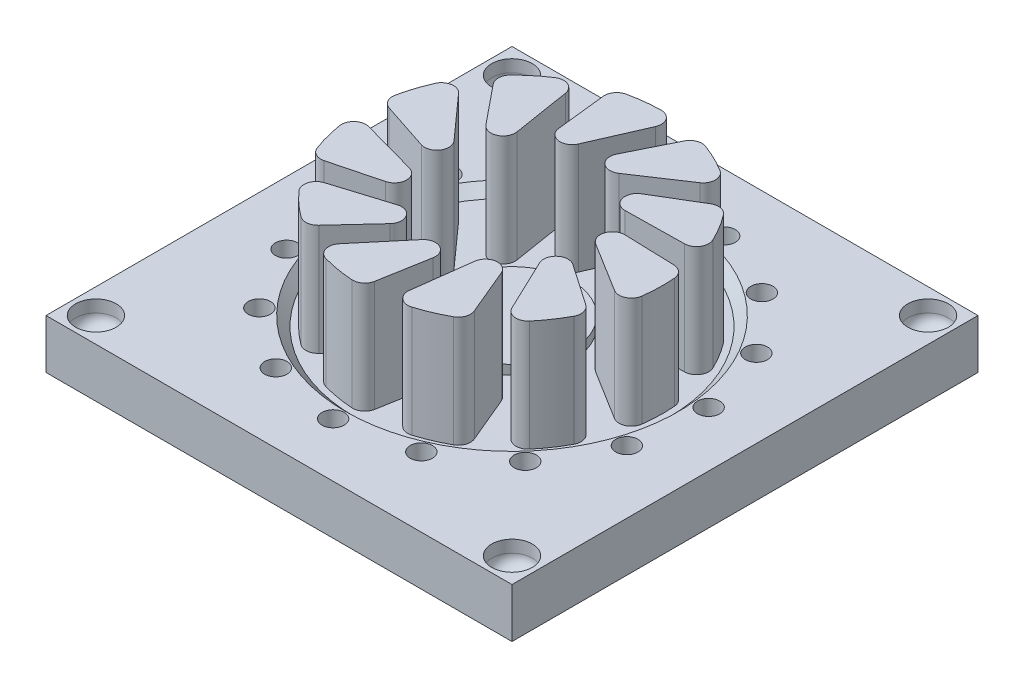
from build123d import *

# Parameters (mm, degrees)
SKETCH1_W               = 42
SKETCH1_H               = 42
BOSS_EXTRUDE1_DEPTH     = 6.5
SKETCH2_R               = 14
SKETCH2_R_2             = 5.9
BOSS_EXTRUDE2_DEPTH     = 9.15
CAVITY1_START           = 5.65
CAVITY1_OUTLINE_R       = 5.4
CAVITY1_DEPTH           = 10
SKETCH5_W               = 42
SKETCH5_H               = 42
CUT_EXTRUDE1_DEPTH      = 8.55
SKETCH6_R               = 1.83
CUT_EXTRUDE2_DEPTH      = 2.1
FILLET1_R               = 1
CUT_EXTRUDE5_DEPTH      = 33.66435366
CUT_EXTRUDE5_DEPTH_BACK = 33.66435366
SKETCH8_R               = 1
CUT_EXTRUDE6_START      = -10
CUT_EXTRUDE6_DEPTH      = 10


with BuildPart() as part:
    # Sketch1 → Boss-Extrude1 (new, symmetric)
    with BuildSketch(Plane(origin=(0, 0, 0), x_dir=(1, 0, 0), z_dir=(0, 1, 0))):
        Rectangle(SKETCH1_W, SKETCH1_H)
    extrude(amount=BOSS_EXTRUDE1_DEPTH, both=True)

    # Sketch2 → Boss-Extrude2 (add)
    with BuildSketch(Plane(origin=(0, 6.5, 0), x_dir=(1, 0, 0), z_dir=(0, 1, 0))):
        with Locations(Location((0, 0, 0), (0, 0, 270))):
            Circle(SKETCH2_R)
        with Locations(Location((0, 0, 0), (0, 0, 270))):
            Circle(SKETCH2_R_2, mode=Mode.SUBTRACT)
    extrude(amount=BOSS_EXTRUDE2_DEPTH)

    # Cavity1: read off the stored shape, not the designer's step
    # Cavity1 outline → Cavity1 (cut)
    with BuildSketch(Plane(origin=(0, 0, 0), x_dir=(1, 0, 0), z_dir=(0, 1, 0)).offset(CAVITY1_START)):
        with BuildLine():
            Line((-4.533292403, -11.068981767), (-1.149066665, -7.035818585))
            ThreePointArc((-1.149066665, -7.035818585), (0.633927393, -6.640538319), (1.47721163, -8.260472267))
            Line((1.47721163, -8.260472267), (0.68813613, -12.7355418))
            ThreePointArc((0.68813613, -12.7355418), (0.138338934, -13.654010782), (-0.883764559, -13.972077877))
            ThreePointArc((-0.883764559, -13.972077877), (1.633368507, -13.904391656), (4.097662599, -13.3869026))
            ThreePointArc((4.097662599, -13.3869026), (2.691904846, -13.099521272), (2.170695102, -11.762702927))
            Line((2.170695102, -11.762702927), (2.83719432, -6.540139582))
            ThreePointArc((2.83719432, -6.540139582), (4.123439724, -5.243649297), (5.708657981, -6.150510574))
            Line((5.708657981, -6.150510574), (7.46425068, -10.341785051))
            ThreePointArc((7.46425068, -10.341785051), (7.498293668, -11.411693133), (6.810405547, -12.231859069))
            ThreePointArc((6.810405547, -12.231859069), (8.891358698, -10.814052918), (10.684679103, -9.046415448))
            ThreePointArc((10.684679103, -9.046415448), (9.346710352, -9.564664912), (8.185502249, -8.721849019))
            Line((8.185502249, -8.721849019), (5.922666155, -3.968012472))
            ThreePointArc((5.922666155, -3.968012472), (6.303789078, -2.181938673), (8.127645759, -2.087805232))
            Line((8.127645759, -2.087805232), (11.870518379, -4.664584621))
            ThreePointArc((11.870518379, -4.664584621), (12.477593142, -5.546243546), (12.342320013, -6.608111432))
            ThreePointArc((12.342320013, -6.608111432), (13.326405326, -4.290328786), (13.879385486, -1.833755311))
            ThreePointArc((13.879385486, -1.833755311), (13.03400136, -2.993095023), (11.601470268, -2.911869673))
            Line((11.601470268, -2.911869673), (7.127733334, -0.136069439))
            ThreePointArc((7.127733334, -0.136069439), (6.48272994, 1.572522062), (7.966163435, 2.63776352))
            Line((7.966163435, 2.63776352), (12.507980365, 2.493588468))
            ThreePointArc((12.507980365, 2.493588468), (13.495344957, 2.08009918), (13.955635081, 1.113664893))
            ThreePointArc((13.955635081, 1.113664893), (13.530412422, 3.59554442), (12.667485044, 5.961109181))
            ThreePointArc((12.667485044, 5.961109181), (12.583089031, 4.528761388), (11.334053449, 3.82260772))
            Line((11.334053449, 3.82260772), (6.069795541, 3.73907468))
            ThreePointArc((6.069795541, 3.73907468), (4.603449851, 4.827718154), (5.275480507, 6.525860991))
            Line((5.275480507, 6.525860991), (9.174246963, 8.860064838))
            ThreePointArc((9.174246963, 8.860064838), (10.228420101, 9.046025113), (11.138134616, 8.481860484))
            ThreePointArc((11.138134616, 8.481860484), (9.438609176, 10.339857679), (7.433747604, 11.863363627))
            ThreePointArc((7.433747604, 11.863363627), (8.137134842, 10.612768057), (7.468154743, 9.343434171))
            Line((7.468154743, 9.343434171), (3.084740551, 6.427089007))
            ThreePointArc((3.084740551, 6.427089007), (1.262606961, 6.550147844), (0.909869793, 8.342043708))
            Line((0.909869793, 8.342043708), (2.927754972, 12.413533223))
            ThreePointArc((2.927754972, 12.413533223), (3.714044133, 13.139901989), (4.78435511, 13.157125301))
            ThreePointArc((4.78435511, 13.157125301), (2.350114207, 13.801339182), (-0.160152175, 13.999083944))
            ThreePointArc((-0.160152175, 13.999083944), (1.107697836, 13.327295854), (1.231169673, 11.89778629))
            Line((1.231169673, 11.89778629), (-0.879697769, 7.074547986))
            ThreePointArc((-0.879697769, 7.074547986), (-2.479104719, 6.192951873), (-3.744618151, 7.509686489))
            Line((-3.744618151, 7.509686489), (-4.248278536, 12.02579252))
            ThreePointArc((-4.248278536, 12.02579252), (-3.979514604, 13.061952825), (-3.08842334, 13.655095799))
            ThreePointArc((-3.08842334, 13.655095799), (-5.484525418, 12.88099301), (-7.70320477, 11.690194022))
            ThreePointArc((-7.70320477, 11.690194022), (-6.273425408, 11.810501383), (-5.396703069, 10.674675328))
            Line((-5.396703069, 10.674675328), (-4.564838262, 5.475887966))
            ThreePointArc((-4.564838262, 5.475887966), (-5.433718166, 3.869537441), (-7.210216291, 4.293056871))
            Line((-7.210216291, 4.293056871), (-10.075513626, 7.819947663))
            ThreePointArc((-10.075513626, 7.819947663), (-10.409605573, 8.836925932), (-9.980649201, 9.817669863))
            ThreePointArc((-9.980649201, 9.817669863), (-11.577866975, 7.871022571), (-12.800544279, 5.669750096))
            ThreePointArc((-12.800544279, 5.669750096), (-11.66278041, 6.543956173), (-10.311160718, 6.062430373))
            Line((-10.311160718, 6.062430373), (-6.800674861, 2.138672207))
            ThreePointArc((-6.800674861, 2.138672207), (-6.663164489, 0.317572211), (-8.386621704, -0.28658797))
            Line((-8.386621704, -0.28658797), (-12.703844329, 1.131324675))
            ThreePointArc((-12.703844329, 1.131324675), (-13.534720323, 1.806237493), (-13.70408946, 2.863203114))
            ThreePointArc((-13.70408946, 2.863203114), (-13.995317572, 0.362058079), (-13.833801424, -2.150799424))
            ThreePointArc((-13.833801424, -2.150799424), (-13.349285037, -0.800248885), (-11.951897694, -0.474593391))
            Line((-11.951897694, -0.474593391), (-6.877345242, -1.877556866))
            ThreePointArc((-6.877345242, -1.877556866), (-5.777103166, -3.335219951), (-6.900333982, -4.775243156))
            Line((-6.900333982, -4.775243156), (-11.29879422, -5.916485904))
            ThreePointArc((-11.29879422, -5.916485904), (-12.362657002, -5.797918587), (-13.076578144, -5.000310394))
            ThreePointArc((-13.076578144, -5.000310394), (-11.969353727, -7.261857295), (-10.474924362, -9.288485324))
            ThreePointArc((-10.474924362, -9.288485324), (-10.797485986, -7.890380576), (-9.7979916, -6.860937106))
            Line((-9.7979916, -6.860937106), (-4.770507103, -5.2976749))
            ThreePointArc((-4.770507103, -5.2976749), (-3.056852407, -5.929103345), (-3.223238977, -7.74779238))
            Line((-3.223238977, -7.74779238), (-6.306456779, -11.085854011))
            ThreePointArc((-6.306456779, -11.085854011), (-7.265537434, -11.561276482), (-8.297345663, -11.276260681))
            ThreePointArc((-8.297345663, -11.276260681), (-6.143204645, -12.580184287), (-3.790332827, -13.477142763))
            ThreePointArc((-3.790332827, -13.477142763), (-4.817561427, -12.475372185), (-4.533292403, -11.068981767))
        make_face()
        Circle(CAVITY1_OUTLINE_R, mode=Mode.SUBTRACT)
    extrude(amount=CAVITY1_DEPTH, mode=Mode.SUBTRACT)

    # Cavity1 2 outline → Cavity1 2 (revolve, cut)
    with BuildSketch(Plane.XY):
        Polygon((14, 6.5), (14, 5.65), (14.15, 5.65), (15, 6.5), align=None)
    revolve(axis=Axis((0, 0, 0), (0, 1, 0)), mode=Mode.SUBTRACT)

    # Sketch5 → Cut-Extrude1 (cut)
    with BuildSketch(Plane.XZ.offset(6.5)):
        Rectangle(SKETCH5_W, SKETCH5_H)
    extrude(amount=-CUT_EXTRUDE1_DEPTH, mode=Mode.SUBTRACT)

    # Sketch6 → Cut-Extrude2 (cut)
    with BuildSketch(Plane(origin=(0, 6.5, 0), x_dir=(1, 0, 0), z_dir=(0, 1, 0))):
        with Locations(Location((-18.75, -18.75, 0), (0, 0, 270))):
            Circle(SKETCH6_R)
        with Locations(Location((18.75, -18.75, 0), (0, 0, 270))):
            Circle(SKETCH6_R)
        with Locations(Location((18.75, 18.75, 0), (0, 0, 270))):
            Circle(SKETCH6_R)
        with Locations(Location((-18.75, 18.75, 0), (0, 0, 270))):
            Circle(SKETCH6_R)
    extrude(amount=-CUT_EXTRUDE2_DEPTH, mode=Mode.SUBTRACT)

    # Fillet1
    fillet1_edges = [part.edges().sort_by_distance(p)[0] for p in [
        (18.75, 4.4, -20.58),
        (-18.75, 4.4, 16.92),
        (-18.75, 4.4, -20.58),
        (18.75, 4.4, 16.92),
    ]]
    fillet(fillet1_edges, radius=FILLET1_R)

    # Sketch8 → Cut-Extrude5 (cut, two sides: drawn at the far end of the back side and taken through both)
    with BuildSketch(Plane.XZ.offset(-2.05).offset(-CUT_EXTRUDE5_DEPTH_BACK)):
        with Locations(Location((0, 16.125, 0), (0, 0, 270))):
            Circle(SKETCH8_R)
        with Locations(Location((6.55862837, 14.730920504, 0), (0, 0, 270))):
            Circle(SKETCH8_R)
        with Locations(Location((11.983210311, 10.789731028, 0), (0, 0, 270))):
            Circle(SKETCH8_R)
        with Locations(Location((15.335786325, 4.982899034, 0), (0, 0, 270))):
            Circle(SKETCH8_R)
        with Locations(Location((16.036665563, -1.68552147, 0), (0, 0, 270))):
            Circle(SKETCH8_R)
        with Locations(Location((13.964659636, -8.0625, 0), (0, 0, 270))):
            Circle(SKETCH8_R)
        with Locations(Location((9.478037193, -13.045399034, 0), (0, 0, 270))):
            Circle(SKETCH8_R)
        with Locations(Location((3.352576014, -15.772630062, 0), (0, 0, 270))):
            Circle(SKETCH8_R)
        with Locations(Location((-3.352576014, -15.772630062, 0), (0, 0, 270))):
            Circle(SKETCH8_R)
        with Locations(Location((-9.478037193, -13.045399034, 0), (0, 0, 270))):
            Circle(SKETCH8_R)
        with Locations(Location((-13.964659636, -8.0625, 0), (0, 0, 270))):
            Circle(SKETCH8_R)
        with Locations(Location((-16.036665563, -1.68552147, 0), (0, 0, 270))):
            Circle(SKETCH8_R)
        with Locations(Location((-15.335786325, 4.982899034, 0), (0, 0, 270))):
            Circle(SKETCH8_R)
        with Locations(Location((-11.983210311, 10.789731028, 0), (0, 0, 270))):
            Circle(SKETCH8_R)
        with Locations(Location((-6.55862837, 14.730920504, 0), (0, 0, 270))):
            Circle(SKETCH8_R)
    extrude(amount=CUT_EXTRUDE5_DEPTH + CUT_EXTRUDE5_DEPTH_BACK, mode=Mode.SUBTRACT)

    # Sketch9 → Cut-Extrude6 (cut)
    # profile 1 of 11: a face of its own
    with BuildSketch(Plane(origin=(0, 15.65, 0), x_dir=(1, 0, 0), z_dir=(0, 1, 0)).offset(CUT_EXTRUDE6_START)):
        with BuildLine():
            Line((-6.800674861, 2.138672207), (-10.311160718, 6.062430373))
            ThreePointArc((-10.311160718, 6.062430373), (-11.662780409, 6.543956173), (-12.800544279, 5.669750096))
            ThreePointArc((-12.800544279, 5.669750096), (-13.326405326, 4.290328786), (-13.70408946, 2.863203114))
            ThreePointArc((-13.70408946, 2.863203114), (-13.534720323, 1.806237493), (-12.703844329, 1.131324675))
            Line((-12.703844329, 1.131324675), (-8.386621704, -0.28658797))
            ThreePointArc((-8.386621704, -0.28658797), (-6.663164489, 0.317572211), (-6.800674861, 2.138672207))
        make_face()
        with BuildLine():
            Line((-7.09878064, 1.871964607), (-10.609266497, 5.795722772))
            ThreePointArc((-10.609266497, 5.795722772), (-11.600454271, 6.148841693), (-12.434814443, 5.507757237))
            ThreePointArc((-12.434814443, 5.507757237), (-12.945650888, 4.167747964), (-13.312544047, 2.78139731))
            ThreePointArc((-13.312544047, 2.78139731), (-13.188340013, 2.006289188), (-12.579030951, 1.511353122))
            Line((-12.579030951, 1.511353122), (-8.261808325, 0.093440477))
            ThreePointArc((-8.261808325, 0.093440477), (-6.997939701, 0.536491277), (-7.09878064, 1.871964607))
        make_face(mode=Mode.SUBTRACT)
    # profile 2 of 11: a face of its own
    with BuildSketch(Plane(origin=(0, 15.65, 0), x_dir=(1, 0, 0), z_dir=(0, 1, 0)).offset(CUT_EXTRUDE6_START)):
        with BuildLine():
            Line((-6.877345242, -1.877556866), (-11.951897694, -0.474593391))
            ThreePointArc((-11.951897694, -0.474593391), (-13.349285037, -0.800248885), (-13.833801424, -2.150799424))
            ThreePointArc((-13.833801424, -2.150799424), (-13.530412422, -3.595544421), (-13.076578144, -5.000310394))
            ThreePointArc((-13.076578144, -5.000310394), (-12.362657002, -5.797918587), (-11.29879422, -5.916485904))
            Line((-11.29879422, -5.916485904), (-6.900333982, -4.775243156))
            ThreePointArc((-6.900333982, -4.775243156), (-5.777103166, -3.335219951), (-6.877345242, -1.877556866))
        make_face()
        with BuildLine():
            Line((-6.983934768, -2.26309373), (-12.058487219, -0.860130254))
            ThreePointArc((-12.058487219, -0.860130254), (-13.083237937, -1.098944283), (-13.438549955, -2.089348012))
            ThreePointArc((-13.438549955, -2.089348012), (-13.14382921, -3.49281458), (-12.702961626, -4.857444382))
            ThreePointArc((-12.702961626, -4.857444382), (-12.179419455, -5.442357058), (-11.399253414, -5.529306423))
            Line((-11.399253414, -5.529306423), (-7.000793177, -4.388063676))
            ThreePointArc((-7.000793177, -4.388063676), (-6.177090578, -3.332046659), (-6.983934768, -2.26309373))
        make_face(mode=Mode.SUBTRACT)
    # profile 3 of 11: a face of its own
    with BuildSketch(Plane(origin=(0, 15.65, 0), x_dir=(1, 0, 0), z_dir=(0, 1, 0)).offset(CUT_EXTRUDE6_START)):
        with BuildLine():
            Line((-4.770507103, -5.2976749), (-9.7979916, -6.860937106))
            ThreePointArc((-9.7979916, -6.860937106), (-10.797485986, -7.890380577), (-10.474924362, -9.288485324))
            ThreePointArc((-10.474924362, -9.288485324), (-9.438609176, -10.339857679), (-8.297345663, -11.276260681))
            ThreePointArc((-8.297345663, -11.276260681), (-7.265537434, -11.561276482), (-6.306456779, -11.085854011))
            Line((-6.306456779, -11.085854011), (-3.223238977, -7.74779238))
            ThreePointArc((-3.223238977, -7.74779238), (-3.056852407, -5.929103345), (-4.770507103, -5.2976749))
        make_face()
        with BuildLine():
            Line((-4.651738953, -5.679635797), (-9.67922345, -7.242898003))
            ThreePointArc((-9.67922345, -7.242898003), (-10.412186, -7.997823214), (-10.175640808, -9.023100029))
            ThreePointArc((-10.175640808, -9.023100029), (-9.168934628, -10.044433174), (-8.060278644, -10.954081805))
            ThreePointArc((-8.060278644, -10.954081805), (-7.303619276, -11.163093392), (-6.600293462, -10.814450247))
            Line((-6.600293462, -10.814450247), (-3.51707566, -7.476388615))
            ThreePointArc((-3.51707566, -7.476388615), (-3.395058842, -6.142683323), (-4.651738953, -5.679635797))
        make_face(mode=Mode.SUBTRACT)
    # profile 4 of 11: a face of its own
    with BuildSketch(Plane(origin=(0, 15.65, 0), x_dir=(1, 0, 0), z_dir=(0, 1, 0)).offset(CUT_EXTRUDE6_START)):
        with BuildLine():
            Line((-1.149066665, -7.035818585), (-4.533292403, -11.068981767))
            ThreePointArc((-4.533292403, -11.068981767), (-4.817561427, -12.475372186), (-3.790332827, -13.477142763))
            ThreePointArc((-3.790332827, -13.477142763), (-2.350114207, -13.801339182), (-0.883764559, -13.972077877))
            ThreePointArc((-0.883764559, -13.972077877), (0.138338934, -13.654010782), (0.68813613, -12.7355418))
            Line((0.68813613, -12.7355418), (1.47721163, -8.260472267))
            ThreePointArc((1.47721163, -8.260472267), (0.633927393, -6.640538319), (-1.149066665, -7.035818585))
        make_face()
        with BuildLine():
            Line((-0.842648887, -7.292933629), (-4.226874626, -11.326096811))
            ThreePointArc((-4.226874626, -11.326096811), (-4.435338577, -12.357449785), (-3.682037603, -13.092081542))
            ThreePointArc((-3.682037603, -13.092081542), (-2.282968087, -13.407015205), (-0.858514143, -13.572875652))
            ThreePointArc((-0.858514143, -13.572875652), (-0.108971581, -13.339626449), (0.294213029, -12.666082529))
            Line((0.294213029, -12.666082529), (1.083288528, -8.191012995))
            ThreePointArc((1.083288528, -8.191012995), (0.464880088, -7.003061434), (-0.842648887, -7.292933629))
        make_face(mode=Mode.SUBTRACT)
    # profile 5 of 11: a face of its own
    with BuildSketch(Plane(origin=(0, 15.65, 0), x_dir=(1, 0, 0), z_dir=(0, 1, 0)).offset(CUT_EXTRUDE6_START)):
        with BuildLine():
            Line((2.83719432, -6.540139582), (2.170695102, -11.762702927))
            ThreePointArc((2.170695102, -11.762702927), (2.691904846, -13.099521272), (4.097662599, -13.3869026))
            ThreePointArc((4.097662599, -13.3869026), (5.484525418, -12.88099301), (6.810405547, -12.231859069))
            ThreePointArc((6.810405547, -12.231859069), (7.498293668, -11.411693133), (7.46425068, -10.341785051))
            Line((7.46425068, -10.341785051), (5.708657981, -6.150510574))
            ThreePointArc((5.708657981, -6.150510574), (4.123439724, -5.243649297), (2.83719432, -6.540139582))
        make_face()
        with BuildLine():
            Line((3.233976246, -6.590776564), (2.567477027, -11.813339908))
            ThreePointArc((2.567477027, -11.813339908), (2.949697506, -12.793673362), (3.980586525, -13.004419669))
            ThreePointArc((3.980586525, -13.004419669), (5.327824692, -12.512964639), (6.615822532, -11.882377381))
            ThreePointArc((6.615822532, -11.882377381), (7.12027382, -11.280922362), (7.095308962, -10.496323102))
            Line((7.095308962, -10.496323102), (5.339716263, -6.305048624))
            ThreePointArc((5.339716263, -6.305048624), (4.177222875, -5.640017021), (3.233976246, -6.590776564))
        make_face(mode=Mode.SUBTRACT)
    # profile 6 of 11: a face of its own
    with BuildSketch(Plane(origin=(0, 15.65, 0), x_dir=(1, 0, 0), z_dir=(0, 1, 0)).offset(CUT_EXTRUDE6_START)):
        with BuildLine():
            Line((5.922666155, -3.968012472), (8.185502249, -8.721849019))
            ThreePointArc((8.185502249, -8.721849019), (9.346710351, -9.564664912), (10.684679103, -9.046415448))
            ThreePointArc((10.684679103, -9.046415448), (11.577866975, -7.871022571), (12.342320013, -6.608111432))
            ThreePointArc((12.342320013, -6.608111432), (12.477593142, -5.546243546), (11.870518379, -4.664584621))
            Line((11.870518379, -4.664584621), (8.127645759, -2.087805232))
            ThreePointArc((8.127645759, -2.087805232), (6.303789078, -2.181938673), (5.922666155, -3.968012472))
        make_face()
        with BuildLine():
            Line((6.283836771, -3.796094507), (8.546672864, -8.549931054))
            ThreePointArc((8.546672864, -8.549931054), (9.398225473, -9.167996042), (10.379402557, -8.787946436))
            ThreePointArc((10.379402557, -8.787946436), (11.247070776, -7.646136212), (11.989682298, -6.419308249))
            ThreePointArc((11.989682298, -6.419308249), (12.088882593, -5.640605132), (11.643694433, -4.994055254))
            Line((11.643694433, -4.994055254), (7.900821813, -2.417275864))
            ThreePointArc((7.900821813, -2.417275864), (6.563326914, -2.486307055), (6.283836771, -3.796094507))
        make_face(mode=Mode.SUBTRACT)
    # profile 7 of 11: a face of its own
    with BuildSketch(Plane(origin=(0, 15.65, 0), x_dir=(1, 0, 0), z_dir=(0, 1, 0)).offset(CUT_EXTRUDE6_START)):
        with BuildLine():
            Line((7.127733334, -0.136069439), (11.601470268, -2.911869673))
            ThreePointArc((11.601470268, -2.911869673), (13.03400136, -2.993095023), (13.879385486, -1.833755311))
            ThreePointArc((13.879385486, -1.833755311), (13.995317572, -0.362058079), (13.955635081, 1.113664893))
            ThreePointArc((13.955635081, 1.113664893), (13.495344957, 2.08009918), (12.507980365, 2.493588468))
            Line((12.507980365, 2.493588468), (7.966163435, 2.63776352))
            ThreePointArc((7.966163435, 2.63776352), (6.48272994, 1.572522063), (7.127733334, -0.136069439))
        make_face()
        with BuildLine():
            Line((7.338623521, 0.203820733), (11.812360455, -2.571979501))
            ThreePointArc((11.812360455, -2.571979501), (12.862883256, -2.631544758), (13.482831615, -1.781362302))
            ThreePointArc((13.482831615, -1.781362302), (13.595451356, -0.351713563), (13.55690265, 1.081845896))
            ThreePointArc((13.55690265, 1.081845896), (13.219356559, 1.790564373), (12.495289192, 2.093789851))
            Line((12.495289192, 2.093789851), (7.953472262, 2.237964903))
            ThreePointArc((7.953472262, 2.237964903), (6.865621032, 1.456787834), (7.338623521, 0.203820733))
        make_face(mode=Mode.SUBTRACT)
    # profile 8 of 11: a face of its own
    with BuildSketch(Plane(origin=(0, 15.65, 0), x_dir=(1, 0, 0), z_dir=(0, 1, 0)).offset(CUT_EXTRUDE6_START)):
        with BuildLine():
            Line((6.069795541, 3.73907468), (11.334053449, 3.82260772))
            ThreePointArc((11.334053449, 3.82260772), (12.583089031, 4.528761388), (12.667485044, 5.961109181))
            ThreePointArc((12.667485044, 5.961109181), (11.969353727, 7.261857295), (11.138134616, 8.481860484))
            ThreePointArc((11.138134616, 8.481860484), (10.228420101, 9.046025113), (9.174246963, 8.860064838))
            Line((9.174246963, 8.860064838), (5.275480507, 6.525860991))
            ThreePointArc((5.275480507, 6.525860991), (4.603449851, 4.827718155), (6.069795541, 3.73907468))
        make_face()
        with BuildLine():
            Line((6.063449155, 4.139024331), (11.327707063, 4.222557371))
            ThreePointArc((11.327707063, 4.222557371), (12.24366649, 4.740403394), (12.3055569, 5.790791776))
            ThreePointArc((12.3055569, 5.790791776), (11.627372192, 7.054375658), (10.819902199, 8.239521613))
            ThreePointArc((10.819902199, 8.239521613), (10.152778221, 8.653242341), (9.37971792, 8.516871472))
            Line((9.37971792, 8.516871472), (5.480951464, 6.182667626))
            ThreePointArc((5.480951464, 6.182667626), (4.988128983, 4.937362879), (6.063449155, 4.139024331))
        make_face(mode=Mode.SUBTRACT)
    # profile 9 of 11: a face of its own
    with BuildSketch(Plane(origin=(0, 15.65, 0), x_dir=(1, 0, 0), z_dir=(0, 1, 0)).offset(CUT_EXTRUDE6_START)):
        with BuildLine():
            Line((3.084740551, 6.427089007), (7.468154743, 9.343434171))
            ThreePointArc((7.468154743, 9.343434171), (8.137134842, 10.612768057), (7.433747604, 11.863363627))
            ThreePointArc((7.433747604, 11.863363627), (6.143204644, 12.580184287), (4.78435511, 13.157125301))
            ThreePointArc((4.78435511, 13.157125301), (3.714044133, 13.139901989), (2.927754972, 12.413533223))
            Line((2.927754972, 12.413533223), (0.909869793, 8.342043708))
            ThreePointArc((0.909869793, 8.342043708), (1.262606961, 6.550147844), (3.084740551, 6.427089007))
        make_face()
        with BuildLine():
            Line((2.863172525, 6.760116949), (7.246586717, 9.676462113))
            ThreePointArc((7.246586717, 9.676462113), (7.737172124, 10.607306962), (7.221354816, 11.524410381))
            ThreePointArc((7.221354816, 11.524410381), (5.967684511, 12.22075045), (4.647659249, 12.781207435))
            ThreePointArc((4.647659249, 12.781207435), (3.862764533, 12.768577006), (3.286152482, 12.235906578))
            Line((3.286152482, 12.235906578), (1.268267303, 8.164417063))
            ThreePointArc((1.268267303, 8.164417063), (1.526941226, 6.850360096), (2.863172525, 6.760116949))
        make_face(mode=Mode.SUBTRACT)
    # profile 10 of 11: a face of its own
    with BuildSketch(Plane(origin=(0, 15.65, 0), x_dir=(1, 0, 0), z_dir=(0, 1, 0)).offset(CUT_EXTRUDE6_START)):
        with BuildLine():
            Line((-0.879697769, 7.074547986), (1.231169673, 11.89778629))
            ThreePointArc((1.231169673, 11.89778629), (1.107697836, 13.327295854), (-0.160152175, 13.999083944))
            ThreePointArc((-0.160152175, 13.999083944), (-1.633368507, 13.904391656), (-3.08842334, 13.655095799))
            ThreePointArc((-3.08842334, 13.655095799), (-3.979514604, 13.061952825), (-4.248278536, 12.02579252))
            Line((-4.248278536, 12.02579252), (-3.744618151, 7.509686489))
            ThreePointArc((-3.744618151, 7.509686489), (-2.479104719, 6.192951873), (-0.879697769, 7.074547986))
        make_face()
        with BuildLine():
            Line((-1.246141152, 7.2349202), (0.86472629, 12.058158504))
            ThreePointArc((0.86472629, 12.058158504), (0.774180276, 13.106465518), (-0.155576398, 13.599110117))
            ThreePointArc((-0.155576398, 13.599110117), (-1.586700835, 13.507123323), (-3.000182673, 13.264950205))
            ThreePointArc((-3.000182673, 13.264950205), (-3.6536496, 12.829978691), (-3.85074315, 12.0701278))
            Line((-3.85074315, 12.0701278), (-3.347082766, 7.554021769))
            ThreePointArc((-3.347082766, 7.554021769), (-2.419039582, 6.588416384), (-1.246141152, 7.2349202))
        make_face(mode=Mode.SUBTRACT)
    # profile 11 of 11: a face of its own
    with BuildSketch(Plane(origin=(0, 15.65, 0), x_dir=(1, 0, 0), z_dir=(0, 1, 0)).offset(CUT_EXTRUDE6_START)):
        with BuildLine():
            Line((-4.564838262, 5.475887966), (-5.396703069, 10.674675328))
            ThreePointArc((-5.396703069, 10.674675328), (-6.273425407, 11.810501383), (-7.70320477, 11.690194022))
            ThreePointArc((-7.70320477, 11.690194022), (-8.891358698, 10.814052918), (-9.980649201, 9.817669863))
            ThreePointArc((-9.980649201, 9.817669863), (-10.409605573, 8.836925931), (-10.075513626, 7.819947663))
            Line((-10.075513626, 7.819947663), (-7.210216291, 4.293056871))
            ThreePointArc((-7.210216291, 4.293056871), (-5.433718166, 3.869537441), (-4.564838262, 5.475887966))
        make_face()
        with BuildLine():
            Line((-4.959813817, 5.412687407), (-5.791678624, 10.611474769))
            ThreePointArc((-5.791678624, 10.611474769), (-6.434608339, 11.444413877), (-7.483113205, 11.356188478))
            ThreePointArc((-7.483113205, 11.356188478), (-8.637319878, 10.505079977), (-9.695487795, 9.53716501))
            ThreePointArc((-9.695487795, 9.53716501), (-10.010055801, 8.817952793), (-9.76505504, 8.072168729))
            Line((-9.76505504, 8.072168729), (-6.899757706, 4.545277938))
            ThreePointArc((-6.899757706, 4.545277938), (-5.596992414, 4.234697022), (-4.959813817, 5.412687407))
        make_face(mode=Mode.SUBTRACT)
    extrude(amount=CUT_EXTRUDE6_DEPTH, mode=Mode.SUBTRACT)


solid = part.part
